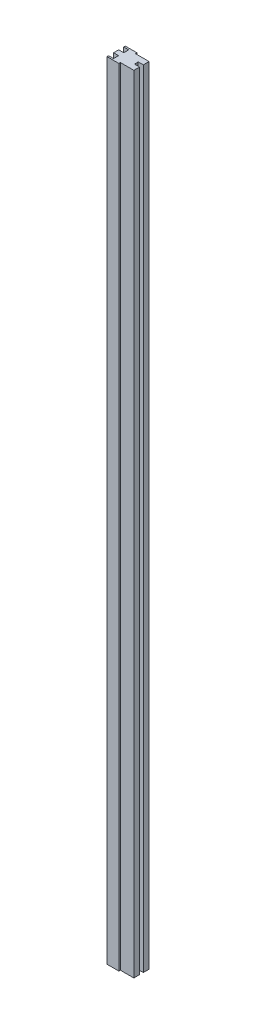
from build123d import *

# Parameters (mm, degrees)
EXTRUDE_1_DEPTH = 1550


with BuildPart() as part:
    # Эскиз1 → Бобышка-Вытянуть1 (new body)
    with BuildSketch(Plane(origin=(0, 0, 0), x_dir=(1, 0, 0), z_dir=(0, 1, 0))):
        Polygon((-10, -14.940308811), (-10, -5), (-20, -5), (-20, 0), (-20, 5), (-10, 5), (-10, 14.940308811), (-20, 14.940308811), (-20, 18), (3.34276046, 18), (3.34276046, 15), (30, 15), (30, 3.685533366), (20, 3.685533366), (20, -3.685533366), (30, -3.685533366), (30, -15), (3.34276046, -15), (3.34276046, -18), (-20, -18), (-20, -14.940308811), align=None)
    extrude(amount=EXTRUDE_1_DEPTH)


solid = part.part
